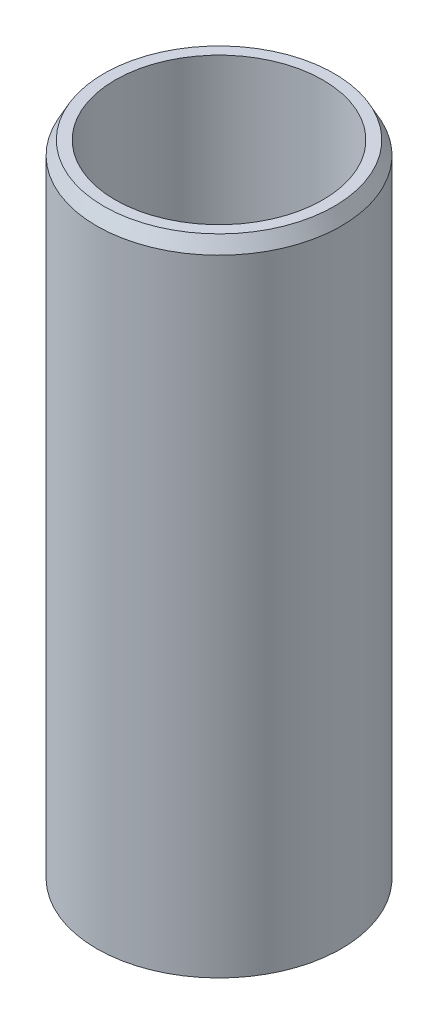
from build123d import *
from OCP.BRepFilletAPI import BRepFilletAPI_MakeChamfer

# Parameters (mm, degrees)
SKETCH1_R           = 50
BOSS_EXTRUDE1_DEPTH = 264.278653375
SKETCH2_R           = 42.455393007
CUT_EXTRUDE1_DEPTH  = 274.574864762
CHAMFER1_SIZE       = 5.477705056
CHAMFER1_SIZE2      = 2.948352727


with BuildPart() as part:
    # Sketch1 → Boss-Extrude1 (new body)
    with BuildSketch(Plane(origin=(0, 0, 0), x_dir=(1, 0, 0), z_dir=(0, 1, 0))):
        Circle(SKETCH1_R)
    extrude(amount=BOSS_EXTRUDE1_DEPTH)

    # Sketch2 → Cut-Extrude1 (cut, through all)
    with BuildSketch(Plane(origin=(0, 0, 0), x_dir=(1, 0, 0), z_dir=(0, 1, 0))):
        Circle(SKETCH2_R)
    extrude(amount=CUT_EXTRUDE1_DEPTH, mode=Mode.SUBTRACT)

    # Chamfer1: one chamfer whose edges measure the first distance from different faces: ONE call of the kernel's chamfer builder (chamfer() names one face for all edges)
    chamfer1_edges_1 = [part.edges().sort_by_distance(p)[0] for p in [
        (-50, 264.278653375, 0),
    ]]
    chamfer1_side_1 = [part.faces().sort_by_distance(p)[0] for p in [
        (-50, 132.139326687, 0),
    ]]
    chamfer1_edges_2 = [part.edges().sort_by_distance(p)[0] for p in [
        (-50, 0, 0),
    ]]
    chamfer1_side_2 = [part.faces().sort_by_distance(p)[0] for p in [
        (-48.585786438, 0, 0),
    ]]
    chamfer1 = BRepFilletAPI_MakeChamfer(part.part.solid().wrapped)
    for e in chamfer1_edges_1:
        chamfer1.Add(CHAMFER1_SIZE, CHAMFER1_SIZE2, e.wrapped, chamfer1_side_1[0].wrapped)  # the first distance lies on this face
    for e in chamfer1_edges_2:
        chamfer1.Add(CHAMFER1_SIZE, CHAMFER1_SIZE2, e.wrapped, chamfer1_side_2[0].wrapped)  # the first distance lies on this face
    add(Compound.cast(chamfer1.Shape()), mode=Mode.REPLACE)


solid = part.part
